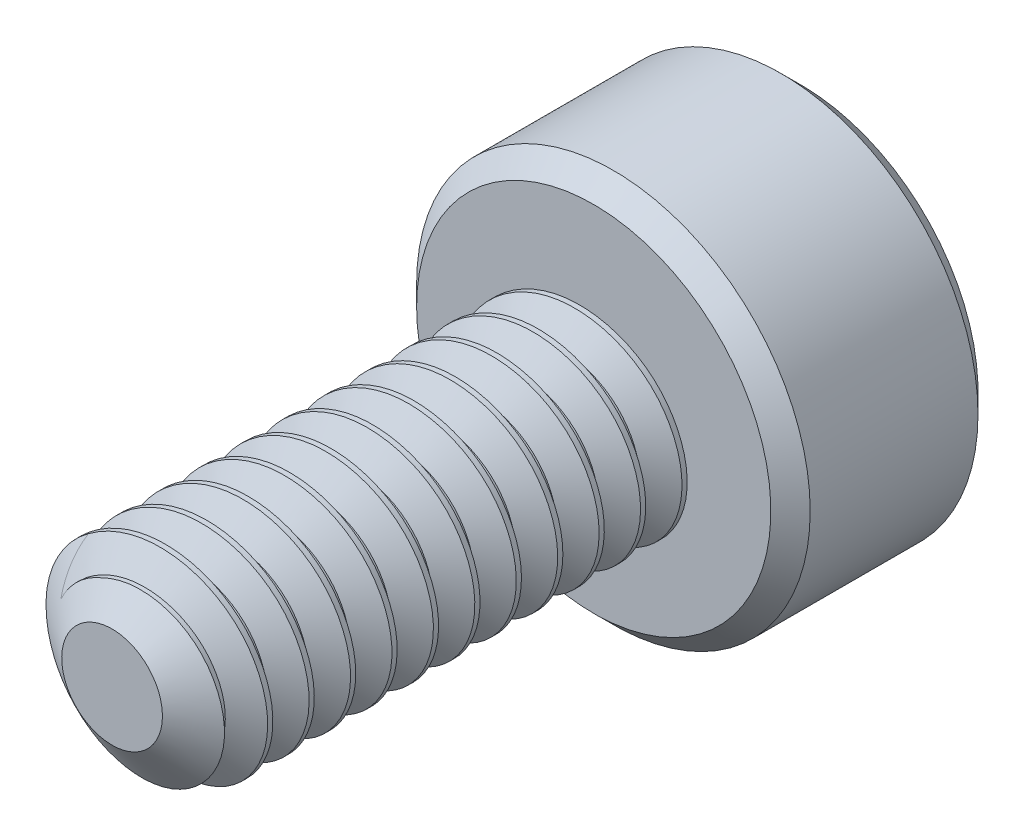
from build123d import *

# Parameters (mm, degrees)
SKETCH1_R          = 1
EXTRUDE1_DEPTH     = 4.65
CUT_SWEEP1_PITCH   = 0.4
SKETCH6_R          = 1.9
EXTRUDE2_DEPTH     = 2
CUT_EXTRUDE1_DEPTH = 1.125
CHAMFER1_SIZE      = 0.19


with BuildPart() as part:
    # Sketch1 → Extrude1 (new body)
    with BuildSketch(Plane.XY):
        Circle(SKETCH1_R)
    extrude(amount=-EXTRUDE1_DEPTH)

    # Cut-Sweep1: the profile of Sketch3 profile screwed along a right-hand helix of 12.625 turns, 6 arcs to a turn; built about Z, then put on its axis
    cut_sweep1_z = Axis((0, 0, 0), (0, 0, 1))
    cut_sweep1_corners = [(1.0003, 0, -0.350173205), (0.740192379, 0, -0.2), (0.740192379, 0, -0.15), (1.0003, 0, 0.000173205)]
    with BuildLine(mode=Mode.PRIVATE) as cut_sweep1_profile:
        Line(cut_sweep1_corners[0], cut_sweep1_corners[1])
        Line(cut_sweep1_corners[1], cut_sweep1_corners[2])
        Line(cut_sweep1_corners[2], cut_sweep1_corners[3])
        Line(cut_sweep1_corners[3], cut_sweep1_corners[0])
    cut_sweep1_cap = Face(cut_sweep1_profile.wire())
    cut_sweep1_turn_angles = [0, 30, 60, 90, 120, 150, 180, 210, 240, 270, 300, 330, 360]
    cut_sweep1_turn_weights = [1, 0.8660254037844387, 1, 0.8660254037844387, 1, 0.8660254037844387, 1, 0.8660254037844387, 1, 0.8660254037844387, 1, 0.8660254037844387, 1]
    cut_sweep1_turn_rails = [Edge.make_bspline([Vector(p[0], p[1], 0).rotate(cut_sweep1_z, cut_sweep1_turn_angles[k]) / cut_sweep1_turn_weights[k] + Vector(0, 0, p[2] + CUT_SWEEP1_PITCH * cut_sweep1_turn_angles[k] / 360) for k in range(13)], [0, 0, 0, 1, 1, 2, 2, 3, 3, 4, 4, 5, 5, 6, 6, 6], 2, cut_sweep1_turn_weights) for p in cut_sweep1_corners]
    cut_sweep1_turn_sides = [Face.make_surface_from_curves(cut_sweep1_turn_rails[p[0]], cut_sweep1_turn_rails[p[1]]) for p in [(0, 1), (1, 2), (2, 3), (3, 0)]]
    cut_sweep1_last_angles = [4320, 4350, 4380, 4410, 4440, 4470, 4500, 4522.5, 4545]
    cut_sweep1_last_weights = [1, 0.8660254037844387, 1, 0.8660254037844387, 1, 0.8660254037844387, 1, 0.9238795325113202, 1]
    cut_sweep1_last_rails = [Edge.make_bspline([Vector(p[0], p[1], 0).rotate(cut_sweep1_z, cut_sweep1_last_angles[k]) / cut_sweep1_last_weights[k] + Vector(0, 0, p[2] + CUT_SWEEP1_PITCH * cut_sweep1_last_angles[k] / 360) for k in range(9)], [0, 0, 0, 1, 1, 2, 2, 3, 3, 4, 4, 4], 2, cut_sweep1_last_weights) for p in cut_sweep1_corners]
    cut_sweep1_last_sides = [Face.make_surface_from_curves(cut_sweep1_last_rails[p[0]], cut_sweep1_last_rails[p[1]]) for p in [(0, 1), (1, 2), (2, 3), (3, 0)]]
    cut_sweep1 = Plane(origin=(0, 0, 0), x_dir=(0, 1, 0), z_dir=(0, 0, -1)) * Solid(Shell([*[p.moved(Location((0, 0, CUT_SWEEP1_PITCH * i))) for i in range(12) for p in cut_sweep1_turn_sides], *cut_sweep1_last_sides, cut_sweep1_cap, cut_sweep1_cap.rotate(cut_sweep1_z, 4545).moved(Location((0, 0, CUT_SWEEP1_PITCH * 4545 / 360)))]))
    add(cut_sweep1, mode=Mode.SUBTRACT)

    # Sketch4 → Cut-Revolve1 (revolve, cut)
    with BuildSketch(Plane(origin=(0, 0, 0), x_dir=(0, 0, -1), z_dir=(1, 0, 0)), mode=Mode.PRIVATE) as cut_revolve1_sk:
        Polygon((0.35977197, 1), (0, 0.486192379), (0, 1), align=None)
    revolve(cut_revolve1_sk.sketch.rotate(Axis((0, 0, 0), (0, 0, -1)), 278.428757719), axis=Axis((0, 0, 0), (0, 0, -1)), mode=Mode.SUBTRACT)

    # Sketch6 → Extrude2 (add)
    with BuildSketch(Plane(origin=(0, 0, -4.65), x_dir=(-1, 0, 0), z_dir=(0, 0, -1))):
        Circle(SKETCH6_R)
    extrude(amount=EXTRUDE2_DEPTH)

    # Sketch7 → Cut-Extrude1 (cut)
    with BuildSketch(Plane(origin=(0, 0, -6.65), x_dir=(-1, 0, 0), z_dir=(0, 0, -1))):
        Polygon((0, 0.866025404), (-0.75, 0.433012702), (-0.75, -0.433012702), (0, -0.866025404), (0.75, -0.433012702), (0.75, 0.433012702), align=None)
    extrude(amount=-CUT_EXTRUDE1_DEPTH, mode=Mode.SUBTRACT)

    # Cut-Extrude2 cone 1 section (through the dimple's axis) → Cut-Extrude2 (revolve, cut)
    with BuildSketch(Plane(origin=(0, 0, -6.65), x_dir=(0, 1, 0), z_dir=(1, 0, 0))):
        Polygon((0, 0), (0.866025404, 0), (0, 0.866025404), align=None)
    revolve(axis=Axis((0, 0, -6.65), (0, 0, 1)), mode=Mode.SUBTRACT)

    # Chamfer1
    chamfer1_edges = [part.edges().sort_by_distance(p)[0] for p in [
        (1.9, 0, -4.65),
        (1.9, 0, -6.65),
    ]]
    chamfer(chamfer1_edges, length=CHAMFER1_SIZE)


solid = part.part
